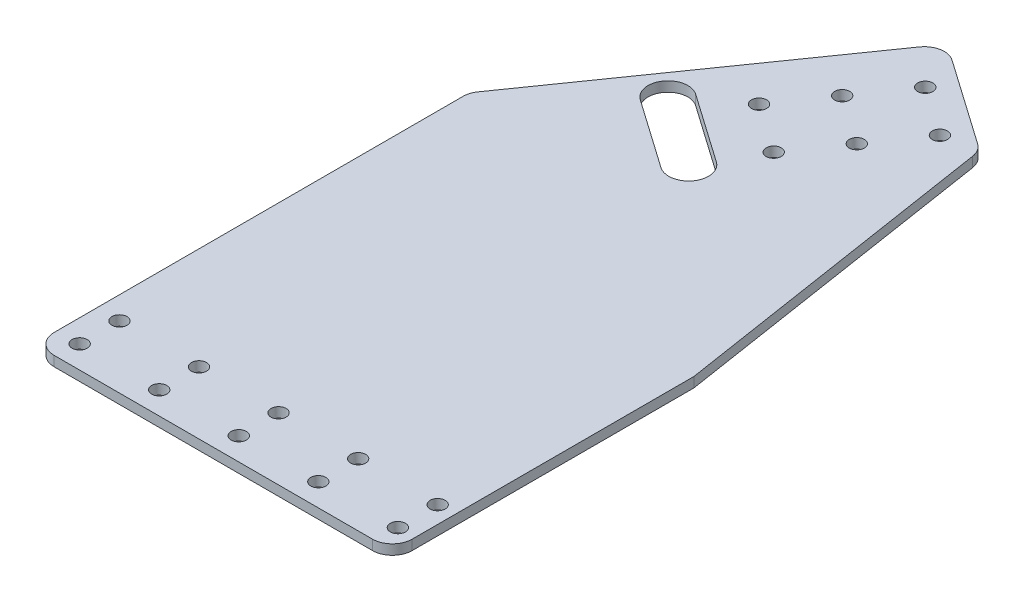
from build123d import *

# Parameters (mm, degrees)
SKETCH1_W           = 114.3
SKETCH1_H           = 228.6
BOSS_EXTRUDE1_DEPTH = 3.175
SKETCH2_R           = 2.413
CUT_EXTRUDE1_DEPTH  = 256.602289945
SKETCH3_R           = 2.413
CUT_EXTRUDE2_DEPTH  = 256.602289945
CUT_EXTRUDE3_DEPTH  = 256.602289945
CUT_EXTRUDE4_DEPTH  = 256.602289945
CUT_EXTRUDE5_DEPTH  = 256.602289945
FILLET1_R           = 6.35


with BuildPart() as part:
    # Sketch1 → Boss-Extrude1 (new body)
    with BuildSketch(Plane(origin=(0, 0, 0), x_dir=(1, 0, 0), z_dir=(0, 1, 0))):
        with Locations((57.15, 114.3)):
            Rectangle(SKETCH1_W, SKETCH1_H)
    extrude(amount=BOSS_EXTRUDE1_DEPTH)

    # Sketch2 → Cut-Extrude1 (cut, through all)
    with BuildSketch(Plane(origin=(0, 3.175, 0), x_dir=(1, 0, 0), z_dir=(0, 1, 0))):
        with Locations((7.239, 7.239)):
            Circle(SKETCH2_R)
        with Locations((7.239, 19.939)):
            Circle(SKETCH2_R)
        with Locations((32.639, 19.939)):
            Circle(SKETCH2_R)
        with Locations((58.039, 19.939)):
            Circle(SKETCH2_R)
        with Locations((83.439, 19.939)):
            Circle(SKETCH2_R)
        with Locations((108.839, 19.939)):
            Circle(SKETCH2_R)
        with Locations((32.639, 7.239)):
            Circle(SKETCH2_R)
        with Locations((58.039, 7.239)):
            Circle(SKETCH2_R)
        with Locations((83.439, 7.239)):
            Circle(SKETCH2_R)
        with Locations((108.839, 7.239)):
            Circle(SKETCH2_R)
    extrude(amount=-CUT_EXTRUDE1_DEPTH, mode=Mode.SUBTRACT)

    # Sketch3 → Cut-Extrude2 (cut, through all)
    with BuildSketch(Plane.XZ):
        with Locations((71.269320032, -213.168001033)):
            Circle(SKETCH3_R)
        with Locations((60.342688919, -197.56315459)):
            Circle(SKETCH3_R)
        with Locations((49.416057807, -181.958308146)):
            Circle(SKETCH3_R)
        with Locations((75.947535363, -186.636523477)):
            Circle(SKETCH3_R)
        with Locations((65.02090425, -171.031677033)):
            Circle(SKETCH3_R)
        with Locations((86.874166475, -202.241369921)):
            Circle(SKETCH3_R)
    extrude(amount=-CUT_EXTRUDE2_DEPTH, mode=Mode.SUBTRACT)

    # Sketch4 → Cut-Extrude3 (cut, through all)
    with BuildSketch(Plane.XZ):
        Polygon((0, -228.6), (62.828519019, -228.6), (0, -138.871575796), align=None)
        Polygon((114.3, -192.559281014), (62.828519019, -228.6), (114.3, -228.6), align=None)
    extrude(amount=-CUT_EXTRUDE3_DEPTH, mode=Mode.SUBTRACT)

    # Sketch5 → Cut-Extrude4 (cut, through all)
    with BuildSketch(Plane.XZ):
        Polygon((97.477297415, -204.338664177), (114.3, -96.279640507), (114.3, -192.559281014), align=None)
    extrude(amount=-CUT_EXTRUDE4_DEPTH, mode=Mode.SUBTRACT)

    # Sketch6 → Cut-Extrude5 (cut, through all)
    with BuildSketch(Plane.XZ):
        with BuildLine():
            Line((58.586824048, -159.165552546), (36.531974408, -174.608524518))
            ThreePointArc((36.531974408, -174.608524518), (27.688148556, -173.049119407), (29.247553666, -164.205293555))
            Line((29.247553666, -164.205293555), (51.302403307, -148.762321583))
            ThreePointArc((51.302403307, -148.762321583), (60.146229159, -150.321726693), (58.586824048, -159.165552546))
        make_face()
    extrude(amount=-CUT_EXTRUDE5_DEPTH, mode=Mode.SUBTRACT)

    # Fillet1
    fillet1_edges = [part.edges().sort_by_distance(p)[0] for p in [
        (0, 1.5875, -138.871575796),
        (97.477297415, 1.5875, -204.338664177),
        (62.828519019, 1.5875, -228.6),
        (0, 1.5875, 0),
        (114.3, 1.5875, 0),
    ]]
    fillet(fillet1_edges, radius=FILLET1_R)


solid = part.part
